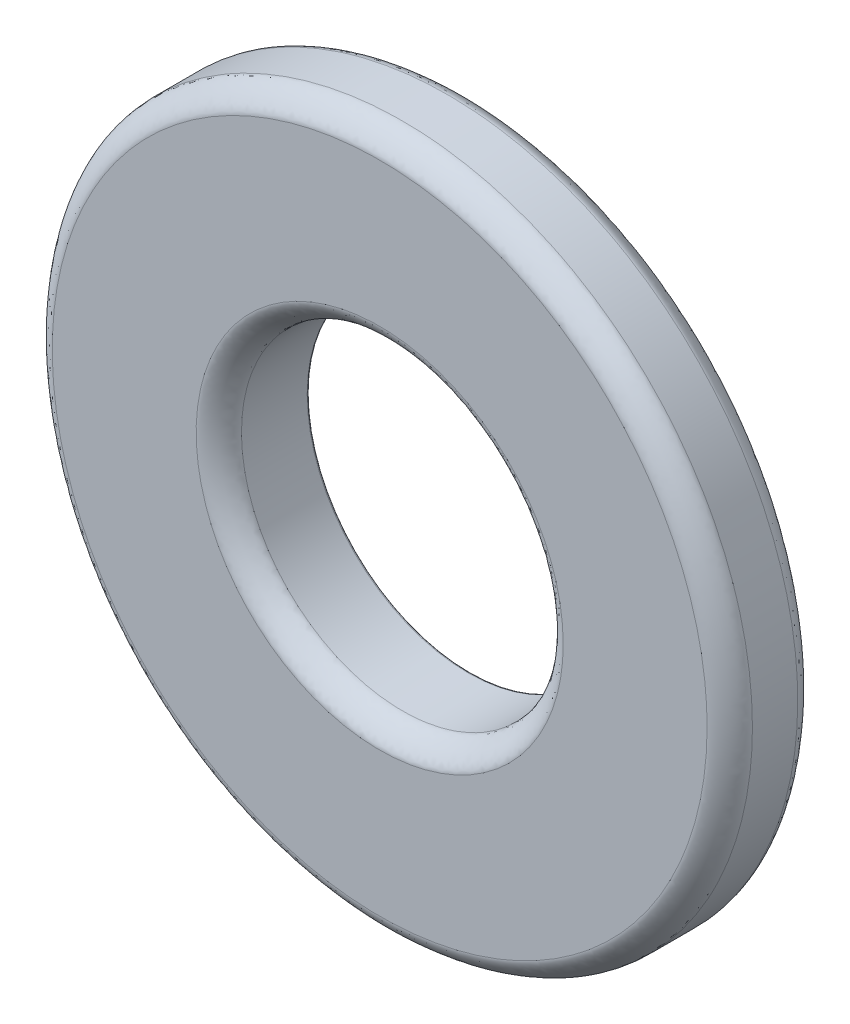
from build123d import *

# Parameters (mm, degrees)
CROQUIS2_R              = 15.45
CROQUIS2_R_2            = 7.1
SALIENTE_EXTRUIR1_DEPTH = 4
REDONDEO1_SIZE          = 1
REDONDEO2_R             = 0.1


with BuildPart() as part:
    # Croquis2 → Saliente-Extruir1 (new body)
    with BuildSketch(Plane(origin=(0, 0, 0), x_dir=(0, 1, 0), z_dir=(0, 0, 1))):
        with Locations(Location((0, 0, 0), (0, 0, 270))):
            Circle(CROQUIS2_R)
        with Locations(Location((0, 0, 0), (0, 0, 270))):
            Circle(CROQUIS2_R_2, mode=Mode.SUBTRACT)
    extrude(amount=SALIENTE_EXTRUIR1_DEPTH)

    # Redondeo1
    # a fillet whose section is not a circle: 1 mm, written as the material it takes off along each edge
    with BuildSketch(Plane(origin=(0, 0, 0), x_dir=(1, 0, 0), z_dir=(0, -1, 0))) as redondeo1_piece_1:
        with BuildLine():
            Bezier((15.45, REDONDEO1_SIZE), (15.45, 0), (15.45 - REDONDEO1_SIZE, 0), weights=[1, 0.353553391, 1])
            Line((15.45 - REDONDEO1_SIZE, 0), (15.45, 0))
            Line((15.45, 0), (15.45, REDONDEO1_SIZE))
        make_face()
    revolve(axis=Axis((0, 0, 0), (0, 0, 1)), mode=Mode.SUBTRACT)
    with BuildSketch(Plane(origin=(0, 0, 4), x_dir=(1, 0, 0), z_dir=(0, -1, 0))) as redondeo1_piece_2:
        with BuildLine():
            Bezier((15.45, -REDONDEO1_SIZE), (15.45, 0), (15.45 - REDONDEO1_SIZE, 0), weights=[1, 0.353553391, 1])
            Line((15.45 - REDONDEO1_SIZE, 0), (15.45, 0))
            Line((15.45, 0), (15.45, -REDONDEO1_SIZE))
        make_face()
    revolve(axis=Axis((0, 0, 4), (0, 0, 1)), mode=Mode.SUBTRACT)
    with BuildSketch(Plane(origin=(0, 0, 4), x_dir=(1, 0, 0), z_dir=(0, -1, 0))) as redondeo1_piece_3:
        with BuildLine():
            Bezier((7.1, -REDONDEO1_SIZE), (7.1, 0), (7.1 + REDONDEO1_SIZE, 0), weights=[1, 0.353553391, 1])
            Line((7.1 + REDONDEO1_SIZE, 0), (7.1, 0))
            Line((7.1, 0), (7.1, -REDONDEO1_SIZE))
        make_face()
    revolve(axis=Axis((0, 0, 4), (0, 0, 1)), mode=Mode.SUBTRACT)

    # Redondeo2
    redondeo2_edges = [part.edges().sort_by_distance(p)[0] for p in [
        (-7.1, 0, 0),
    ]]
    fillet(redondeo2_edges, radius=REDONDEO2_R)


solid = part.part
